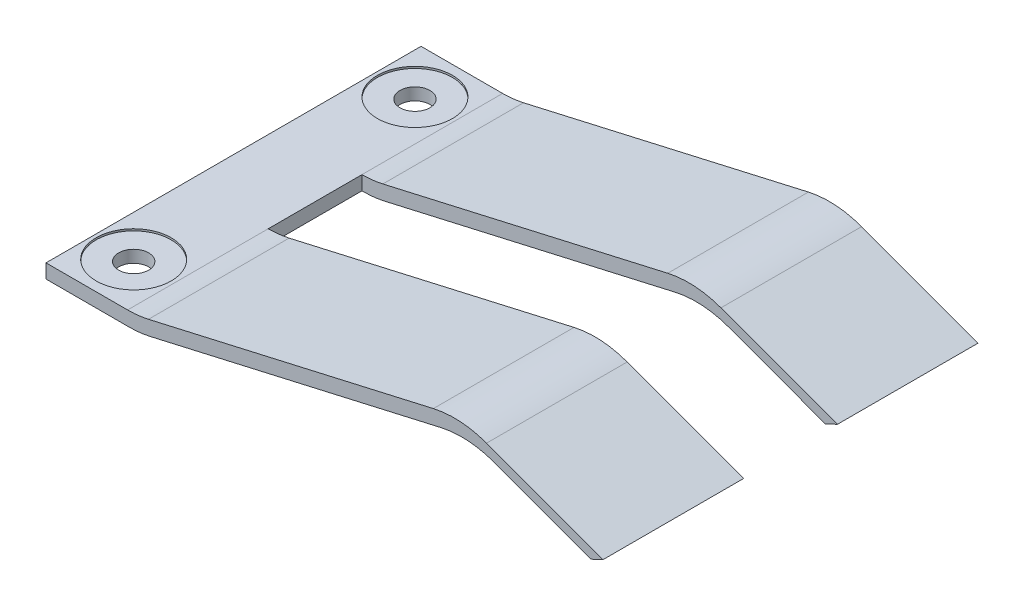
from build123d import *

# Parameters (mm, degrees)
EXTRUDE_1_DEPTH                 = 40
FILLET_1_R                      = 10
CHAMFER_1_SIZE                  = 2
CHAMFER_1_SIZE_2                = 1.558687347
CUT_EXTRUDE_1_REACH             = 74.003
SKETCH_2_R                      = 1.6
SKETCH_3_R                      = 4
CUT_EXTRUDE_2_DEPTH             = 0.2
CUT_EXTRUDE_3_REACH             = 74.003
SKETCH_4_W                      = 50.702932162
SKETCH_4_H                      = 10
CUT_EXTRUDE_3_DIRECTION_2_REACH = 74.003


with BuildPart() as part:
    # 草图1 → 凸台-拉伸1 (new body)
    with BuildSketch(Plane.XY):
        Polygon((0, 0), (10, 0), (45, 8), (60, 2.5), (60, 3.565103021), (44.204382552, 9.356829418), (9.830753848, 1.5), (0, 1.5), align=None)
    extrude(amount=EXTRUDE_1_DEPTH)

    # 圆角1
    fillet_1_edges = [part.edges().sort_by_distance(p)[0] for p in [
        (9.830753848, 1.5, 20),
        (44.204382552, 9.356829418, 20),
        (45, 8, 20),
        (10, 0, 20),
    ]]
    fillet(fillet_1_edges, radius=FILLET_1_R)

    # 倒角1
    # the kernel refuses this chamfer: 2, 1.558687347 mm, written as the material it takes off along each edge
    with BuildSketch(Plane(origin=(60, 2.5, -5.143365976), x_dir=(-0.9479869259850683, 0.31830926496314954, 0), z_dir=(0, 0, 1))) as chamfer_1_piece_1:
        Polygon((CHAMFER_1_SIZE * 0.999621916911, -CHAMFER_1_SIZE * 0.0274958766106), (CHAMFER_1_SIZE_2 * 0.318309265001, -CHAMFER_1_SIZE_2 * 0.947986926099), (0, 0), align=None)
    extrude(amount=50.286731952, mode=Mode.SUBTRACT)

    # 草图2 → 切除-拉伸1 (cut, up to next)
    with BuildSketch(Plane(origin=(0, 1.5, 0), x_dir=(1, 0, 0), z_dir=(0, 1, 0)), mode=Mode.PRIVATE) as cut_extrude_1_sk1:
        with Locations(Location((4.351223085, -5, 0), (0, 0, 270))):
            Circle(SKETCH_2_R)
    cut_extrude_1_tool1 = extrude(cut_extrude_1_sk1.sketch, amount=-CUT_EXTRUDE_1_REACH, mode=Mode.PRIVATE) & part.part
    # 草图2 → 切除-拉伸1 (cut, up to next)
    with BuildSketch(Plane(origin=(0, 1.5, 0), x_dir=(1, 0, 0), z_dir=(0, 1, 0)), mode=Mode.PRIVATE) as cut_extrude_1_sk2:
        with Locations(Location((4.351223085, -35, 0), (0, 0, 270))):
            Circle(SKETCH_2_R)
    cut_extrude_1_tool2 = extrude(cut_extrude_1_sk2.sketch, amount=-CUT_EXTRUDE_1_REACH, mode=Mode.PRIVATE) & part.part
    add(cut_extrude_1_tool1.solids().sort_by_distance((4.351223, 1.5, 5))[0], mode=Mode.SUBTRACT)
    add(cut_extrude_1_tool2.solids().sort_by_distance((4.351223, 1.5, 35))[0], mode=Mode.SUBTRACT)

    # 草图3 → 切除-拉伸2 (cut)
    with BuildSketch(Plane(origin=(0, 1.5, 0), x_dir=(1, 0, 0), z_dir=(0, 1, 0))):
        with Locations(Location((4.351223085, -5, 0), (0, 0, 270))):
            Circle(SKETCH_3_R)
        with Locations(Location((4.351223085, -35, 0), (0, 0, 270))):
            Circle(SKETCH_3_R)
    extrude(amount=-CUT_EXTRUDE_2_DEPTH, mode=Mode.SUBTRACT)

    # 草图4 → 切除-拉伸3 (cut, up to next)
    with BuildSketch(Plane(origin=(0, 1.5, 0), x_dir=(1, 0, 0), z_dir=(0, 1, 0)), mode=Mode.PRIVATE) as cut_extrude_3_sk1:
        with Locations((34.053912252, -20)):
            Rectangle(SKETCH_4_W, SKETCH_4_H)
    cut_extrude_3_tool1 = extrude(cut_extrude_3_sk1.sketch, amount=-CUT_EXTRUDE_3_REACH, mode=Mode.PRIVATE) & part.part
    add(cut_extrude_3_tool1.solids().sort_by_distance((34.053912, 1.5, 20))[0], mode=Mode.SUBTRACT)

    # 草图4 → 切除-拉伸3 direction 2 (cut, up to next)
    with BuildSketch(Plane(origin=(0, 1.5, 0), x_dir=(1, 0, 0), z_dir=(0, 1, 0)), mode=Mode.PRIVATE) as cut_extrude_3_direction_2_sk1:
        with Locations((34.053912252, -20)):
            Rectangle(SKETCH_4_W, SKETCH_4_H)
    cut_extrude_3_direction_2_tool1 = extrude(cut_extrude_3_direction_2_sk1.sketch, amount=CUT_EXTRUDE_3_DIRECTION_2_REACH, mode=Mode.PRIVATE) & part.part
    add(cut_extrude_3_direction_2_tool1.solids().sort_by_distance((34.053912, 1.5, 20))[0], mode=Mode.SUBTRACT)


solid = part.part
